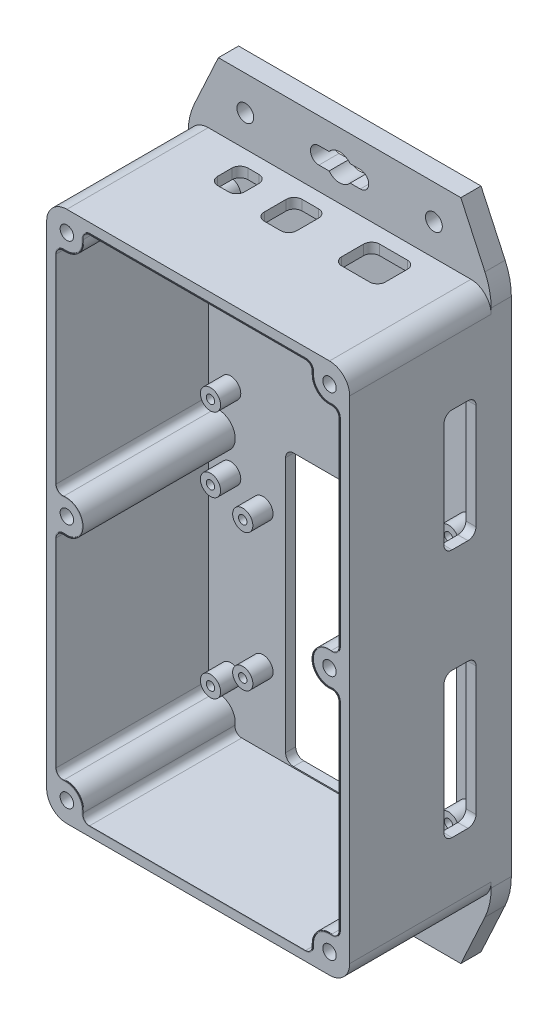
from build123d import *

# Parameters (mm, degrees)
SKETCH1_W             = 158
SKETCH1_H             = 90
BOSS_EXTRUDE1_DEPTH   = 48
BOSS_EXTRUDE2_DEPTH   = 6
HOLE2_D               = 5
CUT_EXTRUDE1_DEPTH    = 187.622613849
SHELL1_START          = 3
SHELL1_OUTLINE_W      = 45
SHELL1_OUTLINE_H      = 84
SHELL1_DEPTH          = 152
SKETCH7_R             = 5
BOSS_EXTRUDE3_DEPTH   = 45
HOLE1_D               = 4
HOLE1_CBORE_D         = 7.5
HOLE1_CBORE_DEPTH     = 42
FILLET3_R             = 2
EXTRUDE_THIN1_DEPTH   = 0.2
SKETCH12_R            = 3
BOSS_EXTRUDE4_DEPTH   = 6
HOLE3_D               = 2.5
HOLE3_DEPTH           = 6
FILLET1_R             = 6
FILLET2_R             = 20
CUT_EXTRUDE2_REACH    = 206.767
SKETCH15_W            = 80.645
SKETCH15_H            = 50.8
FILLET4_R             = 2.38125
CUT_EXTRUDE3_REACH    = 206.767
SKETCH16_W            = 13
SKETCH16_H            = 11.25
SKETCH16_W_2          = 9.65
SKETCH16_W_3          = 8
SKETCH16_H_2          = 9
FILLET5_R             = 2.38125
CUT_EXTRUDE4_REACH    = 206.767
SKETCH17_W            = 43
SKETCH17_H            = 9.5
SKETCH17_W_2          = 36
FILLET6_R             = 2.38125
BODY_MOVE_COPY1_ANGLE = 90
BODY_MOVE_COPY2_ANGLE = 90


# Read off the part's stored shape, not the designer's step: Shell1
with BuildPart() as part:
    # Sketch1 → Boss-Extrude1 (new body)
    with BuildSketch(Plane(origin=(0, 0, 0), x_dir=(1, 0, 0), z_dir=(0, 1, 0))):
        with Locations((79, 45)):
            Rectangle(SKETCH1_W, SKETCH1_H)
    extrude(amount=BOSS_EXTRUDE1_DEPTH)

    # Sketch2 → Boss-Extrude2 (add)
    with BuildSketch(Plane.XZ):
        Polygon((-19.5, -9), (0, 0), (0, -90), (-19.5, -81), align=None)
    boss_extrude2 = extrude(amount=-BOSS_EXTRUDE2_DEPTH)

    # Hole2 (through all)
    with Locations(Plane(origin=(0, 6, 0), x_dir=(1, 0, 0), z_dir=(0, 1, 0))):
        with Locations((-9.3, 73), (-9.3, 17)):
            hole2 = Hole(HOLE2_D / 2)

    # Sketch10 → Cut-Extrude1 (cut, through all)
    with BuildSketch(Plane(origin=(0, 6, 0), x_dir=(1, 0, 0), z_dir=(0, 1, 0))):
        with BuildLine():
            Line((-11.8, 51.15), (-11.8, 48.122498999))
            ThreePointArc((-11.8, 48.122498999), (-13.3, 45), (-11.8, 41.877501001))
            Line((-11.8, 41.877501001), (-11.8, 38.85))
            ThreePointArc((-11.8, 38.85), (-9.3, 36.35), (-6.8, 38.85))
            Line((-6.8, 38.85), (-6.8, 41.877501001))
            ThreePointArc((-6.8, 41.877501001), (-5.3, 45), (-6.8, 48.122498999))
            Line((-6.8, 48.122498999), (-6.8, 51.15))
            ThreePointArc((-6.8, 51.15), (-9.3, 53.65), (-11.8, 51.15))
        make_face()
    cut_extrude1 = extrude(amount=-CUT_EXTRUDE1_DEPTH, mode=Mode.SUBTRACT)

    # Shell1 outline → Shell1 (cut)
    with BuildSketch(Plane.YZ.offset(SHELL1_START)):
        with Locations((25.5, -45)):
            Rectangle(SHELL1_OUTLINE_W, SHELL1_OUTLINE_H)
    extrude(amount=SHELL1_DEPTH, mode=Mode.SUBTRACT)

    # Sketch7 → Boss-Extrude3 (add)
    with BuildSketch(Plane(origin=(0, 3, 0), x_dir=(1, 0, 0), z_dir=(0, 1, 0))):
        with Locations((79, 84)):
            Circle(SKETCH7_R)
        with Locations((6, 84)):
            Circle(SKETCH7_R)
        with Locations((6, 6)):
            Circle(SKETCH7_R)
        with Locations((79, 6)):
            Circle(SKETCH7_R)
        with Locations((152, 6)):
            Circle(SKETCH7_R)
        with Locations((152, 84)):
            Circle(SKETCH7_R)
    extrude(amount=BOSS_EXTRUDE3_DEPTH)

    # Mirror1: Boss-Extrude2, Hole2, Cut-Extrude1 across plane
    add(boss_extrude2.mirror(Plane(origin=(79, 0, 0), x_dir=(0, 0, 1), z_dir=(1, 0, 0))))
    add(hole2.mirror(Plane(origin=(79, 0, 0), x_dir=(0, 0, 1), z_dir=(1, 0, 0))), mode=Mode.SUBTRACT)
    add(cut_extrude1.mirror(Plane(origin=(79, 0, 0), x_dir=(0, 0, 1), z_dir=(1, 0, 0))), mode=Mode.SUBTRACT)

    # Hole1 (through all)
    with Locations(Plane(origin=(0, 0, 0), x_dir=(-1, 0, 0), z_dir=(0, -1, 0))):
        with Locations((-152, 84), (-152, 6), (-79, 84), (-79, 6), (-6, 84), (-6, 6)):
            CounterBoreHole(HOLE1_D / 2, HOLE1_CBORE_D / 2, HOLE1_CBORE_DEPTH)

    # Fillet3
    fillet3_edges = [part.edges().sort_by_distance(p)[0] for p in [
        (3, 25.5, -80),
        (10, 25.5, -87),
        (10, 25.5, -3),
        (3, 25.5, -10),
        (83, 25.5, -3),
        (75, 25.5, -3),
        (155, 25.5, -10),
        (148, 25.5, -3),
        (155, 25.5, -80),
        (148, 25.5, -87),
        (75, 25.5, -87),
        (83, 25.5, -87),
    ]]
    fillet(fillet3_edges, radius=FILLET3_R)

    # Sketch11 → Extrude-Thin1 (add)
    with BuildSketch(Plane(origin=(0, 48, 0), x_dir=(1, 0, 0), z_dir=(0, 1, 0))):
        with BuildLine():
            ThreePointArc((83.750767929, 5.314285714), (79, 10.8), (74.249232071, 5.314285714))
            ThreePointArc((74.249232071, 5.314285714), (73.734840451, 3.559761924), (72.07179677, 2.8))
            Line((72.07179677, 2.8), (12.92820323, 2.8))
            ThreePointArc((12.92820323, 2.8), (11.372568312, 3.444365081), (10.72820323, 5))
            Line((10.72820323, 5), (10.72820323, 5.92820323))
            ThreePointArc((10.72820323, 5.92820323), (9.32231578, 9.32231578), (5.92820323, 10.72820323))
            Line((5.92820323, 10.72820323), (5, 10.72820323))
            ThreePointArc((5, 10.72820323), (3.444365081, 11.372568312), (2.8, 12.92820323))
            Line((2.8, 12.92820323), (2.8, 77.07179677))
            ThreePointArc((2.8, 77.07179677), (3.444365081, 78.627431688), (5, 79.27179677))
            Line((5, 79.27179677), (5.92820323, 79.27179677))
            ThreePointArc((5.92820323, 79.27179677), (9.32231578, 80.67768422), (10.72820323, 84.07179677))
            Line((10.72820323, 84.07179677), (10.72820323, 85))
            ThreePointArc((10.72820323, 85), (11.372568312, 86.555634919), (12.92820323, 87.2))
            Line((12.92820323, 87.2), (72.07179677, 87.2))
            ThreePointArc((72.07179677, 87.2), (73.734840451, 86.440238076), (74.249232071, 84.685714286))
            ThreePointArc((74.249232071, 84.685714286), (79, 79.2), (83.750767929, 84.685714286))
            ThreePointArc((83.750767929, 84.685714286), (84.265159549, 86.440238076), (85.92820323, 87.2))
            Line((85.92820323, 87.2), (145.07179677, 87.2))
            ThreePointArc((145.07179677, 87.2), (146.627431688, 86.555634919), (147.27179677, 85))
            Line((147.27179677, 85), (147.27179677, 84.07179677))
            ThreePointArc((147.27179677, 84.07179677), (148.67768422, 80.67768422), (152.07179677, 79.27179677))
            Line((152.07179677, 79.27179677), (153, 79.27179677))
            ThreePointArc((153, 79.27179677), (154.555634919, 78.627431688), (155.2, 77.07179677))
            Line((155.2, 77.07179677), (155.2, 12.92820323))
            ThreePointArc((155.2, 12.92820323), (154.555634919, 11.372568312), (153, 10.72820323))
            Line((153, 10.72820323), (152.07179677, 10.72820323))
            ThreePointArc((152.07179677, 10.72820323), (148.67768422, 9.32231578), (147.27179677, 5.92820323))
            Line((147.27179677, 5.92820323), (147.27179677, 5))
            ThreePointArc((147.27179677, 5), (146.627431688, 3.444365081), (145.07179677, 2.8))
            Line((145.07179677, 2.8), (85.92820323, 2.8))
            ThreePointArc((85.92820323, 2.8), (84.265159549, 3.559761924), (83.750767929, 5.314285714))
        make_face()
        with BuildLine():
            ThreePointArc((83.948716593, 5.285714286), (79, 11), (74.051283407, 5.285714286))
            ThreePointArc((74.051283407, 5.285714286), (73.583654662, 3.690692659), (72.07179677, 3))
            Line((72.07179677, 3), (12.92820323, 3))
            ThreePointArc((12.92820323, 3), (11.513989668, 3.585786438), (10.92820323, 5))
            Line((10.92820323, 5), (10.92820323, 5.92820323))
            ThreePointArc((10.92820323, 5.92820323), (9.463737136, 9.463737136), (5.92820323, 10.92820323))
            Line((5.92820323, 10.92820323), (5, 10.92820323))
            ThreePointArc((5, 10.92820323), (3.585786438, 11.513989668), (3, 12.92820323))
            Line((3, 12.92820323), (3, 77.07179677))
            ThreePointArc((3, 77.07179677), (3.585786438, 78.486010332), (5, 79.07179677))
            Line((5, 79.07179677), (5.92820323, 79.07179677))
            ThreePointArc((5.92820323, 79.07179677), (9.463737136, 80.536262864), (10.92820323, 84.07179677))
            Line((10.92820323, 84.07179677), (10.92820323, 85))
            ThreePointArc((10.92820323, 85), (11.513989668, 86.414213562), (12.92820323, 87))
            Line((12.92820323, 87), (72.07179677, 87))
            ThreePointArc((72.07179677, 87), (73.583654662, 86.309307341), (74.051283407, 84.714285714))
            ThreePointArc((74.051283407, 84.714285714), (79, 79), (83.948716593, 84.714285714))
            ThreePointArc((83.948716593, 84.714285714), (84.416345338, 86.309307341), (85.92820323, 87))
            Line((85.92820323, 87), (145.07179677, 87))
            ThreePointArc((145.07179677, 87), (146.486010332, 86.414213562), (147.07179677, 85))
            Line((147.07179677, 85), (147.07179677, 84.07179677))
            ThreePointArc((147.07179677, 84.07179677), (148.536262864, 80.536262864), (152.07179677, 79.07179677))
            Line((152.07179677, 79.07179677), (153, 79.07179677))
            ThreePointArc((153, 79.07179677), (154.414213562, 78.486010332), (155, 77.07179677))
            Line((155, 77.07179677), (155, 12.92820323))
            ThreePointArc((155, 12.92820323), (154.414213562, 11.513989668), (153, 10.92820323))
            Line((153, 10.92820323), (152.07179677, 10.92820323))
            ThreePointArc((152.07179677, 10.92820323), (148.536262864, 9.463737136), (147.07179677, 5.92820323))
            Line((147.07179677, 5.92820323), (147.07179677, 5))
            ThreePointArc((147.07179677, 5), (146.486010332, 3.585786438), (145.07179677, 3))
            Line((145.07179677, 3), (85.92820323, 3))
            ThreePointArc((85.92820323, 3), (84.416345338, 3.690692659), (83.948716593, 5.285714286))
        make_face(mode=Mode.SUBTRACT)
    extrude(amount=EXTRUDE_THIN1_DEPTH)

    # Sketch12 → Boss-Extrude4 (add)
    with BuildSketch(Plane(origin=(0, 3, 0), x_dir=(1, 0, 0), z_dir=(0, 1, 0))):
        with Locations(Location((15.531904212, 80.35, 0), (0, 0, 90))):
            Circle(SKETCH12_R)
        with Locations(Location((66.531904212, 80.35, 0), (0, 0, 90))):
            Circle(SKETCH12_R)
        with Locations(Location((140.281904212, 80.35, 0), (0, 0, 90))):
            Circle(SKETCH12_R)
        with Locations(Location((88.531904212, 80.35, 0), (0, 0, 90))):
            Circle(SKETCH12_R)
        with Locations(Location((66.531904212, 9.65, 0), (0, 0, 90))):
            Circle(SKETCH12_R)
        with Locations(Location((15.531904212, 9.65, 0), (0, 0, 90))):
            Circle(SKETCH12_R)
        with Locations(Location((88.531904212, 9.65, 0), (0, 0, 90))):
            Circle(SKETCH12_R)
        with Locations(Location((140.281904212, 9.65, 0), (0, 0, 90))):
            Circle(SKETCH12_R)
        with Locations(Location((92.7201782, 19.233989691, 0), (0, 0, 90))):
            Circle(SKETCH12_R)
        with Locations(Location((133.4201782, 19.233989691, 0), (0, 0, 90))):
            Circle(SKETCH12_R)
    extrude(amount=BOSS_EXTRUDE4_DEPTH)

    # Hole3
    with Locations(Plane(origin=(0, 9, 0), x_dir=(1, 0, 0), z_dir=(0, 1, 0))):
        with Locations((15.531904212, 80.35), (66.531904212, 80.35), (88.531904212, 80.35), (140.281904212, 80.35), (133.4201782, 19.233989691), (92.7201782, 19.233989691), (140.281904212, 9.65), (88.531904212, 9.65), (66.531904212, 9.65), (15.531904212, 9.65)):
            Hole(HOLE3_D / 2, depth=HOLE3_DEPTH)

    # Fillet1
    fillet1_edges = [part.edges().sort_by_distance(p)[0] for p in [
        (0, 27, 0),
        (0, 27, -90),
        (158, 27, 0),
        (158, 27, -90),
    ]]
    fillet(fillet1_edges, radius=FILLET1_R)

    # Fillet2
    fillet2_edges = [part.edges().sort_by_distance(p)[0] for p in [
        (158, 3, -90),
        (158, 3, 0),
        (0, 3, -90),
        (0, 3, 0),
    ]]
    fillet(fillet2_edges, radius=FILLET2_R)

    # Sketch15 → Cut-Extrude2 (cut, up to next)
    with BuildSketch(Plane.XZ, mode=Mode.PRIVATE) as cut_extrude2_sk1:
        with Locations((114.34, -51.35)):
            Rectangle(SKETCH15_W, SKETCH15_H)
    cut_extrude2_tool1 = extrude(cut_extrude2_sk1.sketch, amount=-CUT_EXTRUDE2_REACH, mode=Mode.PRIVATE) & part.part
    add(cut_extrude2_tool1.solids().sort_by_distance((114.34, 0, -51.35))[0], mode=Mode.SUBTRACT)

    # Fillet4
    fillet4_edges = [part.edges().sort_by_distance(p)[0] for p in [
        (74.0175, 1.5, -76.75),
        (74.0175, 1.5, -25.95),
        (154.6625, 1.5, -25.95),
        (154.6625, 1.5, -76.75),
    ]]
    fillet(fillet4_edges, radius=FILLET4_R)

    # Sketch16 → Cut-Extrude3 (cut, up to next)
    with BuildSketch(Plane.ZY, mode=Mode.PRIVATE) as cut_extrude3_sk1:
        with Locations((-65.5, 16.125)):
            Rectangle(SKETCH16_W, SKETCH16_H)
    cut_extrude3_tool1 = extrude(cut_extrude3_sk1.sketch, amount=-CUT_EXTRUDE3_REACH, mode=Mode.PRIVATE) & part.part
    # Sketch16 → Cut-Extrude3 (cut, up to next)
    with BuildSketch(Plane.ZY, mode=Mode.PRIVATE) as cut_extrude3_sk2:
        with Locations((-40.825, 16.125)):
            Rectangle(SKETCH16_W_2, SKETCH16_H)
    cut_extrude3_tool2 = extrude(cut_extrude3_sk2.sketch, amount=-CUT_EXTRUDE3_REACH, mode=Mode.PRIVATE) & part.part
    # Sketch16 → Cut-Extrude3 (cut, up to next)
    with BuildSketch(Plane.ZY, mode=Mode.PRIVATE) as cut_extrude3_sk3:
        with Locations((-23.9, 15)):
            Rectangle(SKETCH16_W_3, SKETCH16_H_2)
    cut_extrude3_tool3 = extrude(cut_extrude3_sk3.sketch, amount=-CUT_EXTRUDE3_REACH, mode=Mode.PRIVATE) & part.part
    add(cut_extrude3_tool1.solids().sort_by_distance((0, 16.125, -65.5))[0], mode=Mode.SUBTRACT)
    add(cut_extrude3_tool2.solids().sort_by_distance((0, 16.125, -40.825))[0], mode=Mode.SUBTRACT)
    add(cut_extrude3_tool3.solids().sort_by_distance((0, 15, -23.9))[0], mode=Mode.SUBTRACT)

    # Fillet5
    fillet5_edges = [part.edges().sort_by_distance(p)[0] for p in [
        (1.5, 10.5, -59),
        (1.5, 21.75, -59),
        (1.5, 21.75, -72),
        (1.5, 10.5, -72),
        (1.5, 10.5, -36),
        (1.5, 21.75, -36),
        (1.5, 21.75, -45.65),
        (1.5, 10.5, -45.65),
        (1.5, 10.5, -19.9),
        (1.5, 19.5, -19.9),
        (1.5, 19.5, -27.9),
        (1.5, 10.5, -27.9),
    ]]
    fillet(fillet5_edges, radius=FILLET5_R)

    # Sketch17 → Cut-Extrude4 (cut, up to next)
    with BuildSketch(Plane(origin=(0, 0, -90), x_dir=(-1, 0, 0), z_dir=(0, 0, -1)), mode=Mode.PRIVATE) as cut_extrude4_sk1:
        with Locations((-113.28, 15.25)):
            Rectangle(SKETCH17_W, SKETCH17_H)
    cut_extrude4_tool1 = extrude(cut_extrude4_sk1.sketch, amount=-CUT_EXTRUDE4_REACH, mode=Mode.PRIVATE) & part.part
    # Sketch17 → Cut-Extrude4 (cut, up to next)
    with BuildSketch(Plane(origin=(0, 0, -90), x_dir=(-1, 0, 0), z_dir=(0, 0, -1)), mode=Mode.PRIVATE) as cut_extrude4_sk2:
        with Locations((-42.78, 15.25)):
            Rectangle(SKETCH17_W_2, SKETCH17_H)
    cut_extrude4_tool2 = extrude(cut_extrude4_sk2.sketch, amount=-CUT_EXTRUDE4_REACH, mode=Mode.PRIVATE) & part.part
    add(cut_extrude4_tool1.solids().sort_by_distance((113.28, 15.25, -90))[0], mode=Mode.SUBTRACT)
    add(cut_extrude4_tool2.solids().sort_by_distance((42.78, 15.25, -90))[0], mode=Mode.SUBTRACT)

    # Fillet6
    fillet6_edges = [part.edges().sort_by_distance(p)[0] for p in [
        (91.78, 10.5, -88.5),
        (91.78, 20, -88.5),
        (134.78, 20, -88.5),
        (134.78, 10.5, -88.5),
        (24.78, 10.5, -88.5),
        (24.78, 20, -88.5),
        (60.78, 20, -88.5),
        (60.78, 10.5, -88.5),
    ]]
    fillet(fillet6_edges, radius=FILLET6_R)


with BuildPart() as part_1:
    # Body-Move/Copy1: moved
    add(part.part.rotate(Axis((79, 24.1, 0), (0, 0, -1)), BODY_MOVE_COPY1_ANGLE))


with BuildPart() as part_2:
    # Body-Move/Copy2: moved
    add(part_1.part.rotate(Axis((79, 0, -45), (0, -1, 0)), BODY_MOVE_COPY2_ANGLE))


solid = part_2.part
